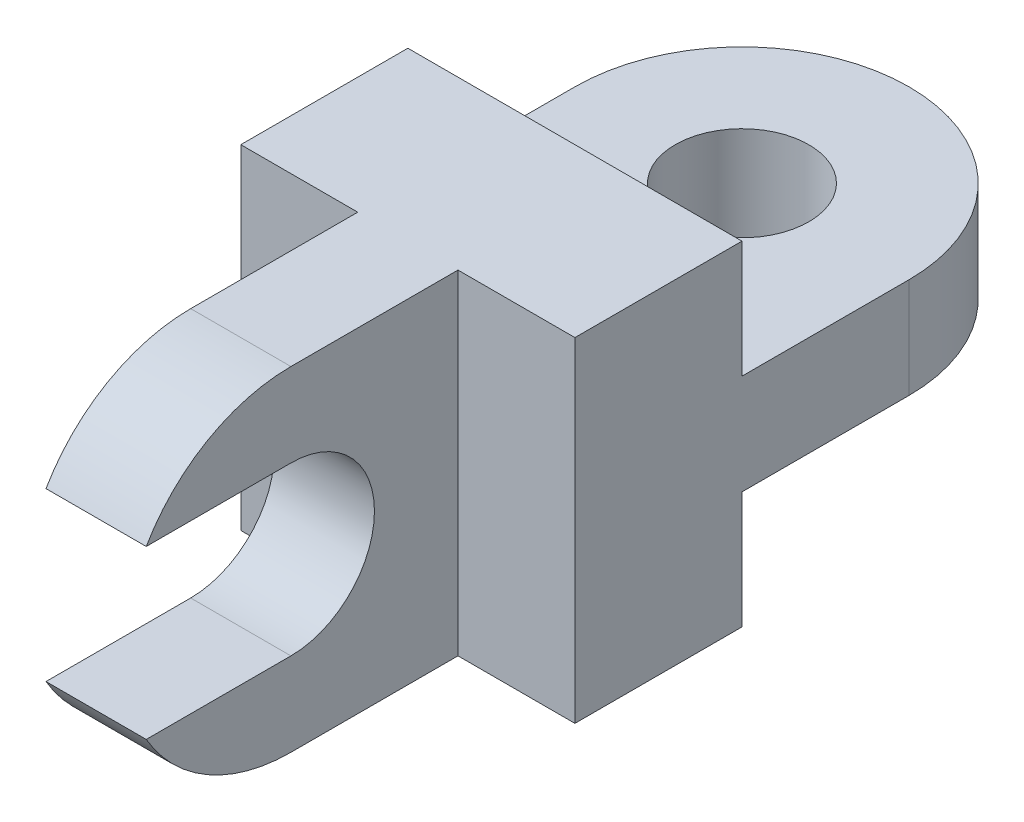
from build123d import *

# Parameters (mm, degrees)
CROQUIS3_R                   = 20
SALIENTE_EXTRUIR1_DEPTH      = 30
CROQUIS4_W                   = 100
CROQUIS4_H                   = 50
SALIENTE_EXTRUIR2_DEPTH      = 65
CROQUIS5_W                   = 100
CROQUIS5_H                   = 50
SALIENTE_EXTRUIR3_DEPTH      = 35
SALIENTE_EXTRUIR4_DEPTH      = 15
SALIENTE_EXTRUIR4_DEPTH_BACK = 15
REDONDEO2_R                  = 50


with BuildPart() as part:
    # Croquis3 → Saliente-Extruir1 (new body)
    with BuildSketch(Plane(origin=(0, 0, 0), x_dir=(1, 0, 0), z_dir=(0, 1, 0))):
        with BuildLine():
            Line((-50, 0), (-50, -50))
            Line((-50, -50), (50, -50))
            Line((50, -50), (50, 0))
            ThreePointArc((50, 0), (0, 50), (-50, 0))
        make_face()
        with Locations(Location((0, 0, 0), (0, 0, 270))):
            Circle(CROQUIS3_R, mode=Mode.SUBTRACT)
    extrude(amount=SALIENTE_EXTRUIR1_DEPTH)

    # Croquis4 → Saliente-Extruir2 (add)
    with BuildSketch(Plane(origin=(0, 0, 0), x_dir=(1, 0, 0), z_dir=(0, 1, 0))):
        with Locations((0, -75)):
            Rectangle(CROQUIS4_W, CROQUIS4_H)
    extrude(amount=SALIENTE_EXTRUIR2_DEPTH)

    # Croquis5 → Saliente-Extruir3 (add)
    with BuildSketch(Plane.XZ):
        with Locations((0, 75)):
            Rectangle(CROQUIS5_W, CROQUIS5_H)
    extrude(amount=SALIENTE_EXTRUIR3_DEPTH)

    # Croquis6 → Saliente-Extruir4 (add, two sides: drawn at the far end of the back side and taken through both)
    with BuildSketch(Plane(origin=(0, 0, 0), x_dir=(0, 0, -1), z_dir=(1, 0, 0)).offset(-SALIENTE_EXTRUIR4_DEPTH_BACK)):
        with BuildLine():
            Line((-100, 65), (-193.3, 65))
            Line((-193.3, 65), (-193.3, 40))
            Line((-193.3, 40), (-150, 40))
            ThreePointArc((-150, 40), (-125, 15), (-150, -10))
            Line((-150, -10), (-193.3, -10))
            Line((-193.3, -10), (-193.3, -35))
            Line((-193.3, -35), (-100, -35))
            Line((-100, -35), (-100, 65))
        make_face()
    extrude(amount=SALIENTE_EXTRUIR4_DEPTH + SALIENTE_EXTRUIR4_DEPTH_BACK)

    # Redondeo2
    # the kernel refuses this fillet: 50 mm, written as the material it takes off along each edge
    with BuildSketch(Plane(origin=(123.253175473, -35, 193.3), x_dir=(0, 0, -1), z_dir=(-1, 0, 0)), Plane(origin=(-123.253175473, 65, 193.3), x_dir=(0, 0, -1), z_dir=(1, 0, 0))) as redondeo2_piece_1:
        with BuildLine():
            CenterArc((43.301270189, -50), REDONDEO2_R, 90, 60)
            Line((0, -25), (-0.866025404, -24.5))
            ThreePointArc((-0.866025404, -24.5), (-1, -12.5), (-1, 0))
            Line((-1, 0), (0, 1))
            Line((0, 1), (43.301270189, 1))
            Line((43.301270189, 1), (43.301270189, 0))
        make_face()
    extrude(amount=246.506350946, mode=Mode.SUBTRACT)


solid = part.part
